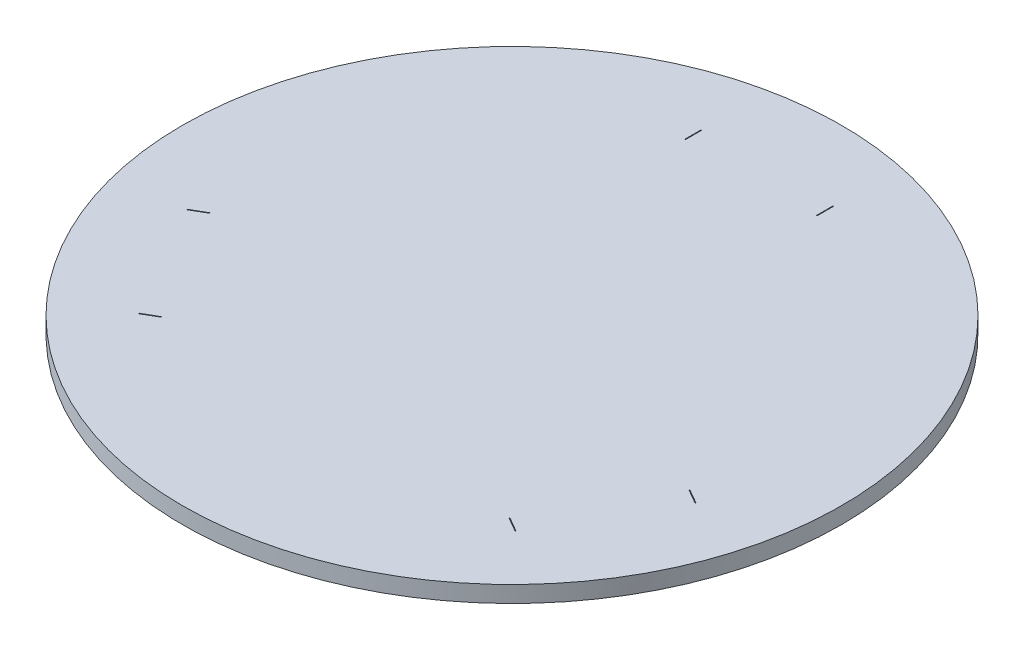
from build123d import *

# Parameters (mm, degrees)
SKETCH2_R           = 100
BOSS_EXTRUDE1_DEPTH = 5
SKETCH3_W           = 0.2
SKETCH3_H           = 5
CUT_EXTRUDE1_DEPTH  = 142.509716981


with BuildPart() as part:
    # Sketch2 → Boss-Extrude1 (new body)
    with BuildSketch(Plane(origin=(0, 0, 0), x_dir=(1, 0, 0), z_dir=(0, 1, 0))):
        Circle(SKETCH2_R)
    extrude(amount=BOSS_EXTRUDE1_DEPTH)

    # Sketch3 → Cut-Extrude1 (cut, through all)
    with BuildSketch(Plane(origin=(0, 5, 0), x_dir=(1, 0, 0), z_dir=(0, 1, 0))):
        Polygon((72.836841774, -18.842889384), (77.166968793, -21.342889384), (77.066968793, -21.516094465), (72.736841774, -19.016094465), align=None)
        with Locations((-20, 75)):
            Rectangle(SKETCH3_W, SKETCH3_H)
        with Locations((20, 75)):
            Rectangle(SKETCH3_W, SKETCH3_H)
        Polygon((52.836841774, -53.483905535), (57.166968793, -55.983905535), (57.066968793, -56.157110616), (52.736841774, -53.657110616), align=None)
        Polygon((-52.736841774, -53.657110616), (-57.066968793, -56.157110616), (-57.166968793, -55.983905535), (-52.836841774, -53.483905535), align=None)
        Polygon((-72.736841774, -19.016094465), (-77.066968793, -21.516094465), (-77.166968793, -21.342889384), (-72.836841774, -18.842889384), align=None)
    extrude(amount=-CUT_EXTRUDE1_DEPTH, mode=Mode.SUBTRACT)

    # Sketch4 → Revolve1 (revolve)
    with BuildSketch(Plane.XY):
        with BuildLine():
            Line((-100, 0), (0, 0))
            Line((0, 0), (0, -31.529878888))
            ThreePointArc((0, -31.529878888), (-52.426456257, -23.460675497), (-100, 0))
        make_face()
    revolve(axis=Axis((0, 0, 0), (0, -1, 0)))


solid = part.part
